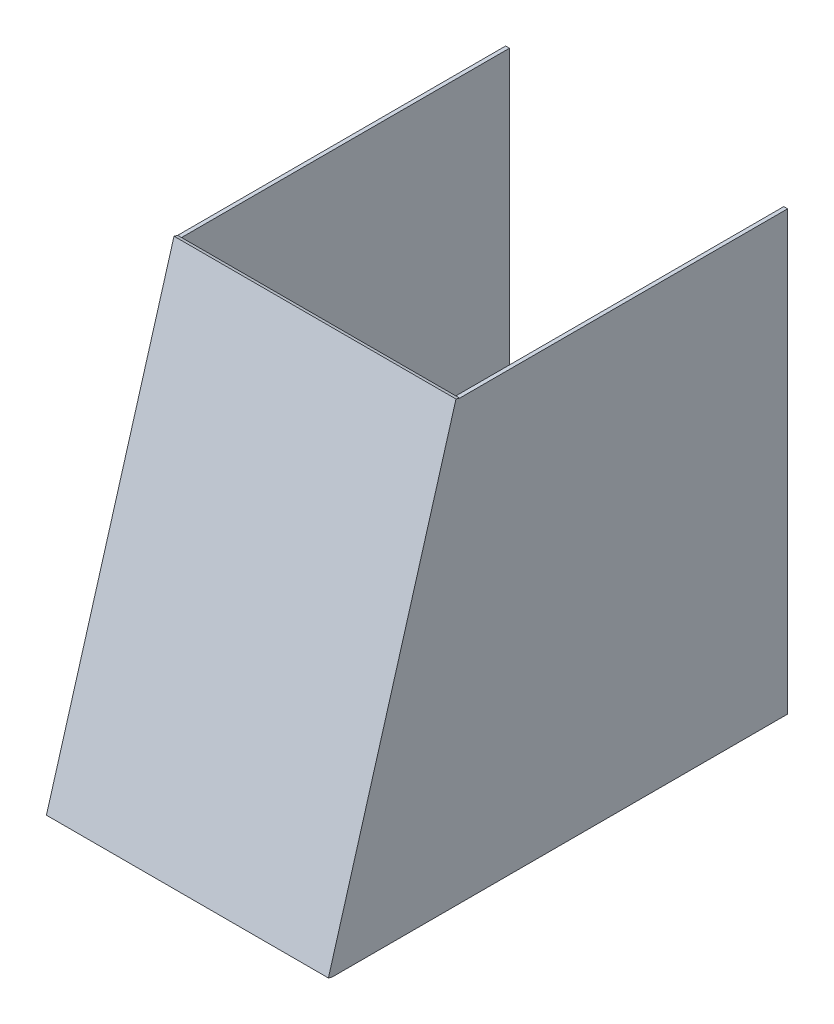
from build123d import *

# Parameters (mm, degrees)
BOSS_EXTRUDE1_DEPTH = 3
SKETCH2_W           = 221
SKETCH2_H           = 357.28000224
BOSS_EXTRUDE2_DEPTH = 3


with BuildPart() as part:
    # Sketch1 → Boss-Extrude1 (new body)
    with BuildSketch(Plane(origin=(107.5, 0, 0), x_dir=(0, 0, -1), z_dir=(1, 0, 0))):
        Polygon((125.5, 330), (-131.5, 330), (-231.5, -13), (125.5, -13), align=None)
    extrude(amount=BOSS_EXTRUDE1_DEPTH)


with BuildPart() as body_2:
    # Mirror2: mirrored copy
    add(part.part.mirror(Plane(origin=(0, 0, 0), x_dir=(0, 0, 1), z_dir=(1, 0, 0))))


with BuildPart() as part_1:
    add(part.part)

    add(body_2.part)  # Boss-Extrude2 merges body 2
    # Sketch2 → Boss-Extrude2 (add)
    with BuildSketch(Plane(origin=(0, 61.18692665, 209.871158411), x_dir=(1, 0, 0), z_dir=(0, 0.27989251951769323, 0.9600313419456876))):
        with Locations((0, 101.364475406)):
            Rectangle(SKETCH2_W, SKETCH2_H)
    extrude(amount=BOSS_EXTRUDE2_DEPTH)


solid = part_1.part
